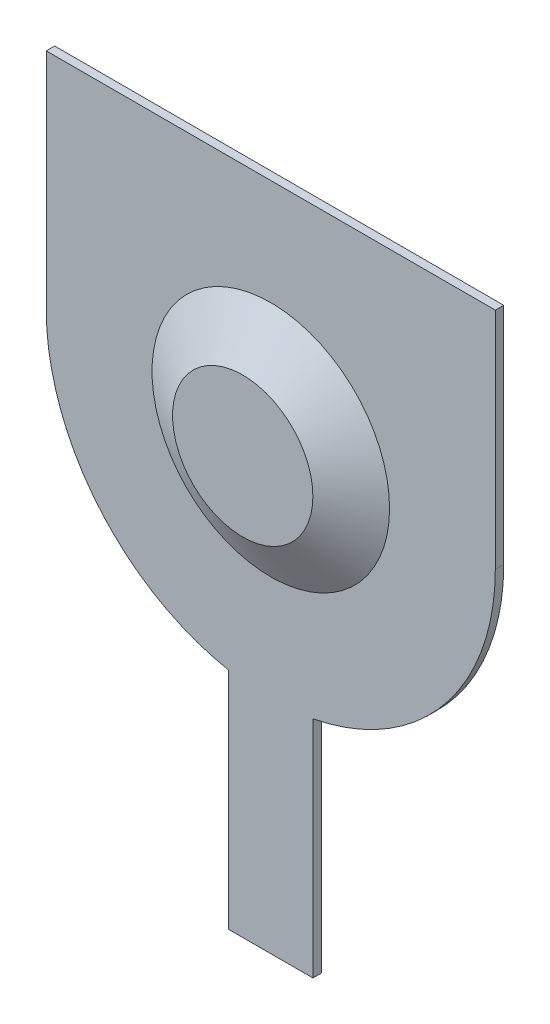
from build123d import *

# Parameters (mm, degrees)
EXTRUDE_1_DEPTH  = 0.3
SKETCH_2_R       = 2.5
EXTRUDE_2_DEPTH  = 1
CHAMFER_1_SIZE   = 1.732050808
CHAMFER_1_SIZE_2 = 1


with BuildPart() as part:
    # 草图1 → 凸台-拉伸1 (new body)
    with BuildSketch(Plane.XY):
        with BuildLine():
            Line((-8, 0), (-8, 8))
            Line((-8, 8), (8, 8))
            Line((8, 8), (8, 0))
            ThreePointArc((8, 0), (6.164414003, -5.099019514), (1.5, -7.858116823))
            Line((1.5, -7.858116823), (1.5, -15.858116823))
            Line((1.5, -15.858116823), (-1.5, -15.858116823))
            Line((-1.5, -15.858116823), (-1.5, -7.858116823))
            ThreePointArc((-1.5, -7.858116823), (-6.164414003, -5.099019514), (-8, 0))
        make_face()
    extrude(amount=EXTRUDE_1_DEPTH)

    # 草图2 → 凸台-拉伸2 (add)
    with BuildSketch(Plane.XY.offset(0.3)):
        Circle(SKETCH_2_R)
    extrude(amount=EXTRUDE_2_DEPTH)

    # 倒角1
    # the kernel refuses this chamfer: 1.732050808, 1 mm, written as the material it adds along each edge
    with BuildSketch(Plane(origin=(0, 0, 0.3), x_dir=(1, 0, 0), z_dir=(0, -1, 0))) as chamfer_1_piece_1_section:
        Polygon((2.5 + CHAMFER_1_SIZE, 0), (2.5, CHAMFER_1_SIZE_2), (2.5, 0), align=None)
    chamfer_1_piece_1 = revolve(axis=Axis((0, 0, 0.3), (0, 0, 1)), mode=Mode.PRIVATE)
    chamfer_1_piece_1 = split(chamfer_1_piece_1, bisect_by=Plane(origin=(-3.382683679, 0, 1.3), z_dir=(0, 0, -1)), keep=Keep.TOP, mode=Mode.PRIVATE)
    add(chamfer_1_piece_1)


solid = part.part
